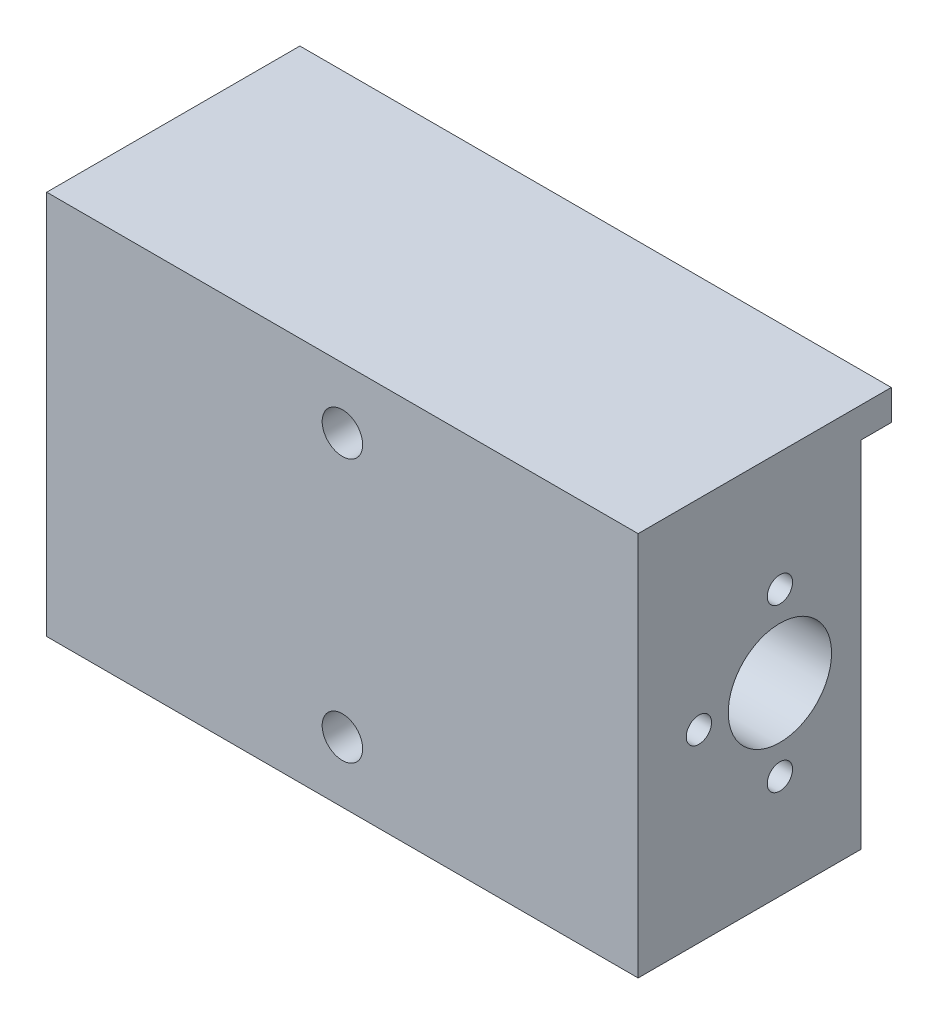
from build123d import *

# Parameters (mm, degrees)
CROQUIS1_W                                     = 58.4
CROQUIS1_H                                     = 38
SALIENTE_EXTRUIR1_DEPTH                        = 22
CROQUIS2_R                                     = 5.1
CORTAR_EXTRUIR1_DEPTH                          = 74.065450112
TALADROS_DE_ESPIGA_DE_4_0MM2_D                 = 4
TALADROS_DE_ESPIGA_DE_4_0MM2_DEPTH             = 14
TALADROS_DE_ESPIGA_DE_4_0MM2_TIP               = 1.201721238
CROQUIS6_W                                     = 58.4
CROQUIS6_H                                     = 3
SALIENTE_EXTRUIR2_DEPTH                        = 3
PERFORADOR_PARA_ROSCAR_PARA_MACHO_DE_ROS_D     = 2.5
PERFORADOR_PARA_ROSCAR_PARA_MACHO_DE_ROS_DEPTH = 14
PERFORADOR_PARA_ROSCAR_PARA_MACHO_DE_ROS_TIP   = 0.751075774


with BuildPart() as part:
    # Croquis1 → Saliente-Extruir1 (new body)
    with BuildSketch(Plane.XY):
        with Locations((29.2, 19)):
            Rectangle(CROQUIS1_W, CROQUIS1_H)
    extrude(amount=SALIENTE_EXTRUIR1_DEPTH)

    # Croquis2 → Cortar-Extruir1 (cut, through all)
    with BuildSketch(Plane(origin=(58.4, 0, 0), x_dir=(0, 0, -1), z_dir=(1, 0, 0))):
        with Locations((-8, 18.236268226)):
            Circle(CROQUIS2_R)
    extrude(amount=-CORTAR_EXTRUIR1_DEPTH, mode=Mode.SUBTRACT)

    # Taladros de espiga de Ø4.0mm2
    with Locations(Plane.XY.offset(22)):
        with Locations((29.2, 6), (29.2, 32)):
            Hole(TALADROS_DE_ESPIGA_DE_4_0MM2_D / 2, depth=TALADROS_DE_ESPIGA_DE_4_0MM2_DEPTH)
            with Locations((0, 0, -(TALADROS_DE_ESPIGA_DE_4_0MM2_DEPTH + TALADROS_DE_ESPIGA_DE_4_0MM2_TIP / 2))):  # 118° drill point
                Cone(0, TALADROS_DE_ESPIGA_DE_4_0MM2_D / 2, TALADROS_DE_ESPIGA_DE_4_0MM2_TIP, mode=Mode.SUBTRACT)

    # Croquis6 → Saliente-Extruir2 (add)
    with BuildSketch(Plane(origin=(0, 0, 0), x_dir=(-1, 0, 0), z_dir=(0, 0, -1))):
        with Locations((-29.2, 36.5)):
            Rectangle(CROQUIS6_W, CROQUIS6_H)
    extrude(amount=SALIENTE_EXTRUIR2_DEPTH)

    # Perforador para roscar para macho de roscar para M32
    with Locations(Plane(origin=(58.4, 0, 0), x_dir=(0, 0, -1), z_dir=(1, 0, 0))):
        with Locations((-16, 18.236268226), (-8, 10.236268226), (-8, 26.236268226)):
            Hole(PERFORADOR_PARA_ROSCAR_PARA_MACHO_DE_ROS_D / 2, depth=PERFORADOR_PARA_ROSCAR_PARA_MACHO_DE_ROS_DEPTH)
            with Locations((0, 0, -(PERFORADOR_PARA_ROSCAR_PARA_MACHO_DE_ROS_DEPTH + PERFORADOR_PARA_ROSCAR_PARA_MACHO_DE_ROS_TIP / 2))):  # 118° drill point
                Cone(0, PERFORADOR_PARA_ROSCAR_PARA_MACHO_DE_ROS_D / 2, PERFORADOR_PARA_ROSCAR_PARA_MACHO_DE_ROS_TIP, mode=Mode.SUBTRACT)


solid = part.part
